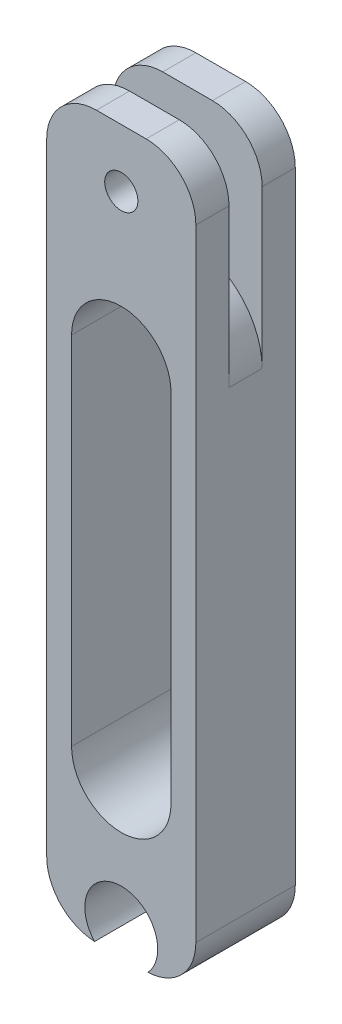
from build123d import *

# Parameters (mm, degrees)
CROQUIS1_R              = 1
SALIENTE_EXTRUIR1_DEPTH = 6
CROQUIS2_W              = 9
CROQUIS2_H              = 2
CORTAR_EXTRUIR1_DEPTH   = 8
REDONDEO1_R             = 4.5
REDONDEO2_R             = 3
CORTAR_EXTRUIR2_DEPTH   = 43.66438796


# Some blends are built 0.0001 mm under size
with BuildPart() as part:
    # Croquis1 → Saliente-Extruir1 (new body)
    with BuildSketch(Plane.XY):
        with BuildLine():
            Line((-4.5, -1.5), (-1.609347694, -1.5))
            ThreePointArc((-1.609347694, -1.5), (0, 2.2), (1.609347694, -1.5))
            Line((1.609347694, -1.5), (4.5, -1.5))
            Line((4.5, -1.5), (4.5, 42))
            Line((4.5, 42), (-4.5, 42))
            Line((-4.5, 42), (-4.5, -1.5))
        make_face()
        with Locations((0, 38.5)):
            Circle(CROQUIS1_R, mode=Mode.SUBTRACT)
    extrude(amount=SALIENTE_EXTRUIR1_DEPTH)

    # Croquis2 → Cortar-Extruir1 (cut)
    with BuildSketch(Plane(origin=(0, 42, 0), x_dir=(1, 0, 0), z_dir=(0, 1, 0))):
        with Locations((0, -3)):
            Rectangle(CROQUIS2_W, CROQUIS2_H)
    extrude(amount=-CORTAR_EXTRUIR1_DEPTH, mode=Mode.SUBTRACT)

    # Redondeo1
    redondeo1_edges = [part.edges().sort_by_distance(p)[0] for p in [
        (-4.5, 34, 3),
        (4.5, 34, 3),
    ]]
    fillet(redondeo1_edges, radius=REDONDEO1_R - 0.0001)  # a hair under: the kernel refuses the full size

    # Redondeo2
    # the kernel refuses this fillet: 3 mm, written as the material it takes off along each edge
    with BuildSketch(Plane(origin=(-4.5, 42, -3.5), x_dir=(0, -1, 0), z_dir=(0, 0, 1)), Plane(origin=(-4.5, 42, -7.5), x_dir=(0, -1, 0), z_dir=(0, 0, 1))) as redondeo2_piece_1:
        with BuildLine():
            CenterArc((REDONDEO2_R, REDONDEO2_R), REDONDEO2_R, 180, 90)
            Line((0, REDONDEO2_R), (-REDONDEO2_R * 0.02, REDONDEO2_R))
            Line((-REDONDEO2_R * 0.02, REDONDEO2_R), (-REDONDEO2_R * 0.02, -REDONDEO2_R * 0.02))
            Line((-REDONDEO2_R * 0.02, -REDONDEO2_R * 0.02), (REDONDEO2_R, -REDONDEO2_R * 0.02))
            Line((REDONDEO2_R, -REDONDEO2_R * 0.02), (REDONDEO2_R, 0))
        make_face()
    extrude(amount=17, mode=Mode.SUBTRACT)
    with BuildSketch(Plane(origin=(4.5, 42, -7.5), x_dir=(0, -1, 0), z_dir=(0, 0, 1)), Plane(origin=(4.5, 42, -3.5), x_dir=(0, -1, 0), z_dir=(0, 0, 1))) as redondeo2_piece_2:
        with BuildLine():
            CenterArc((REDONDEO2_R, -REDONDEO2_R), REDONDEO2_R, 90, 90)
            Line((0, -REDONDEO2_R), (-REDONDEO2_R * 0.02, -REDONDEO2_R))
            Line((-REDONDEO2_R * 0.02, -REDONDEO2_R), (-REDONDEO2_R * 0.02, REDONDEO2_R * 0.02))
            Line((-REDONDEO2_R * 0.02, REDONDEO2_R * 0.02), (REDONDEO2_R, REDONDEO2_R * 0.02))
            Line((REDONDEO2_R, REDONDEO2_R * 0.02), (REDONDEO2_R, 0))
        make_face()
    extrude(amount=17, mode=Mode.SUBTRACT)
    with BuildSketch(Plane(origin=(4.5, -1.5, -7.495016295), x_dir=(0, 1, 0), z_dir=(0, 0, 1))) as redondeo2_piece_3:
        with BuildLine():
            CenterArc((2.998006518, 3), REDONDEO2_R, 182.088849817, 87.911150183)
            Line((0, 2.890652306), (-0.05996013, 2.888465352))
            ThreePointArc((-0.05996013, 2.888465352), (-0.06, 1.445326153), (-0.06, 0))
            Line((-0.06, 0), (0, -0.06))
            Line((0, -0.06), (2.998006518, -0.06))
            Line((2.998006518, -0.06), (2.998006518, 0))
        make_face()
    extrude(amount=20.99003259, mode=Mode.SUBTRACT)
    with BuildSketch(Plane(origin=(-4.5, -1.5, -7.495016295), x_dir=(0, 1, 0), z_dir=(0, 0, 1))) as redondeo2_piece_4:
        with BuildLine():
            CenterArc((2.998006518, -3), REDONDEO2_R, 90, 87.911150183)
            Line((0, -2.890652306), (-0.05996013, -2.888465352))
            ThreePointArc((-0.05996013, -2.888465352), (-0.06, -1.445326153), (-0.06, 0))
            Line((-0.06, 0), (0, 0.06))
            Line((0, 0.06), (2.998006518, 0.06))
            Line((2.998006518, 0.06), (2.998006518, 0))
        make_face()
    extrude(amount=20.99003259, mode=Mode.SUBTRACT)

    # Croquis3 → Cortar-Extruir2 (cut, through all)
    with BuildSketch(Plane.XY.offset(6)):
        with BuildLine():
            Line((-3, 8), (-3, 29.5))
            ThreePointArc((-3, 29.5), (0, 32.5), (3, 29.5))
            Line((3, 29.5), (3, 8))
            ThreePointArc((3, 8), (0, 5), (-3, 8))
        make_face()
    extrude(amount=-CORTAR_EXTRUIR2_DEPTH, mode=Mode.SUBTRACT)


solid = part.part
